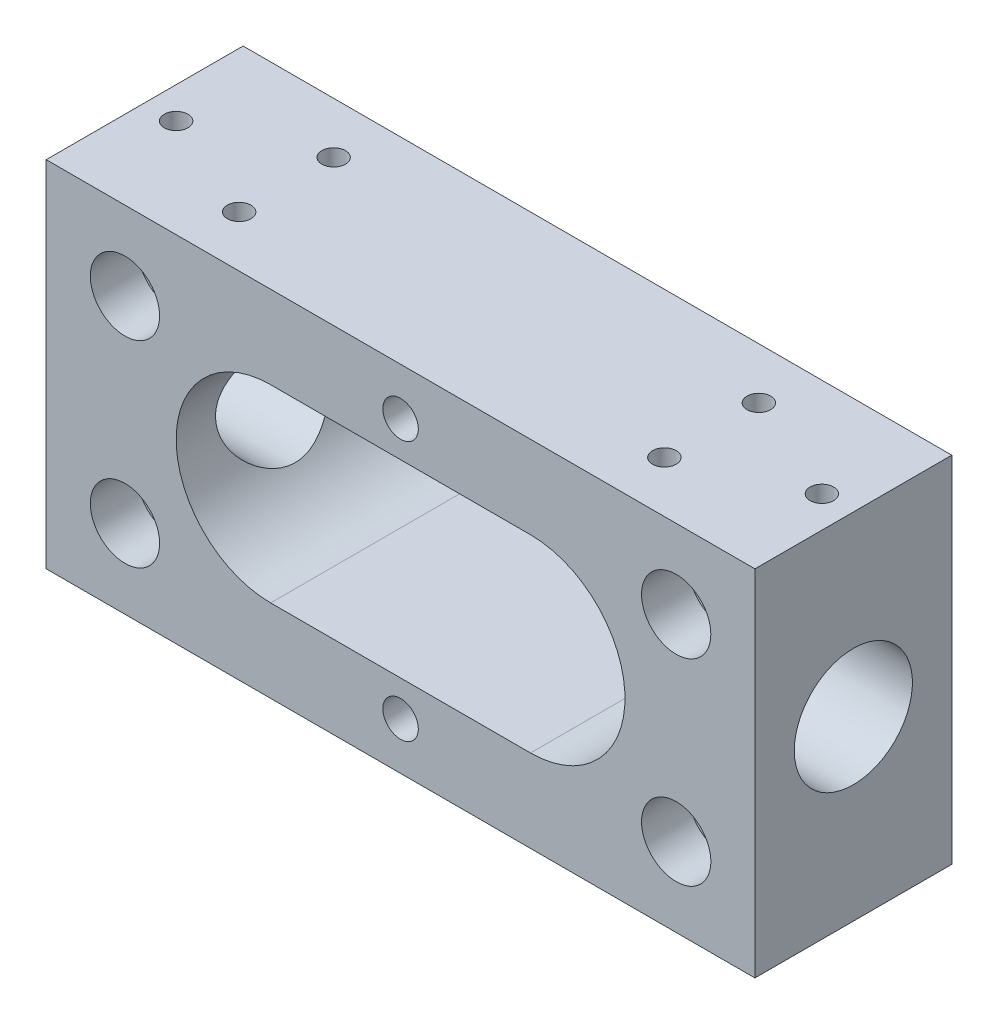
from build123d import *

# Parameters (mm, degrees)
SCHIZZO1_W                                           = 90
SCHIZZO1_H                                           = 45
ESTRUSIONE_ESTRUSIONE1_DEPTH                         = 25
SCHIZZO2_R                                           = 7.5
TAGLIO_ESTRUSIONE1_DEPTH                             = 104.682206767
FORO_LAMATO_PER_VITE_M4_A_TESTA_CILINDRI_D           = 4.5
FORO_LAMATO_PER_VITE_M4_A_TESTA_CILINDRI_CBORE_D     = 8
FORO_LAMATO_PER_VITE_M4_A_TESTA_CILINDRI_CBORE_DEPTH = 2.6
TAGLIO_ESTRUSIONE4_DEPTH                             = 104.682206767
SCHIZZO15_R                                          = 4.4
TAGLIO_ESTRUSIONE5_DEPTH                             = 6
SCHIZZO16_R                                          = 3
TAGLIO_ESTRUSIONE6_DEPTH                             = 103.401171975
SCHIZZO17_R                                          = 5
TAGLIO_ESTRUSIONE8_DEPTH                             = 10
FORO_3_0_3_1_D                                       = 3
FORO_3_0_3_1_DEPTH                                   = 12
FORO_3_0_3_1_TIP                                     = 0.901290929
FORO_3_0_3_2_D                                       = 3
FORO_3_0_3_2_DEPTH                                   = 12
FORO_3_0_3_2_TIP                                     = 0.901290929
FORO_3_0_3_3_D                                       = 3
FORO_3_0_3_3_DEPTH                                   = 12
FORO_3_0_3_3_TIP                                     = 0.901290929


with BuildPart() as part:
    # Schizzo1 → Estrusione-Estrusione1 (new body)
    with BuildSketch(Plane.XY):
        with Locations((45, 22.5)):
            Rectangle(SCHIZZO1_W, SCHIZZO1_H)
    extrude(amount=-ESTRUSIONE_ESTRUSIONE1_DEPTH)

    # Schizzo2 → Taglio-Estrusione1 (cut, through all)
    with BuildSketch(Plane.ZY):
        with Locations((-12.5, 22.5)):
            Circle(SCHIZZO2_R)
    extrude(amount=-TAGLIO_ESTRUSIONE1_DEPTH, mode=Mode.SUBTRACT)

    # Foro lamato per Vite M4 a testa cilindrica piana-1 (through all)
    with Locations(Plane(origin=(45, 39, -25), x_dir=(-1, 0, 0), z_dir=(0, 0, -1))):
        with Locations((0, 0), (0, -33)):
            CounterBoreHole(FORO_LAMATO_PER_VITE_M4_A_TESTA_CILINDRI_D / 2, FORO_LAMATO_PER_VITE_M4_A_TESTA_CILINDRI_CBORE_D / 2, FORO_LAMATO_PER_VITE_M4_A_TESTA_CILINDRI_CBORE_DEPTH)

    # Schizzo14 → Taglio-Estrusione4 (cut, through all)
    with BuildSketch(Plane.XY):
        with BuildLine():
            Line((61.5, 10.5), (28.5, 10.5))
            ThreePointArc((28.5, 10.5), (16.5, 22.5), (28.5, 34.5))
            Line((28.5, 34.5), (61.5, 34.5))
            ThreePointArc((61.5, 34.5), (73.5, 22.5), (61.5, 10.5))
        make_face()
    extrude(amount=-TAGLIO_ESTRUSIONE4_DEPTH, mode=Mode.SUBTRACT)

    # Schizzo15 → Taglio-Estrusione5 (cut)
    with BuildSketch(Plane.XY):
        with Locations((10, 10)):
            Circle(SCHIZZO15_R)
        with Locations((80, 10)):
            Circle(SCHIZZO15_R)
        with Locations((80, 35)):
            Circle(SCHIZZO15_R)
        with Locations((10, 35)):
            Circle(SCHIZZO15_R)
    extrude(amount=-TAGLIO_ESTRUSIONE5_DEPTH, mode=Mode.SUBTRACT)

    # Schizzo16 → Taglio-Estrusione6 (cut, through all)
    with BuildSketch(Plane.XY.offset(-6)):
        with Locations((10, 10)):
            Circle(SCHIZZO16_R)
        with Locations((80, 10)):
            Circle(SCHIZZO16_R)
        with Locations((80, 35)):
            Circle(SCHIZZO16_R)
        with Locations((10, 35)):
            Circle(SCHIZZO16_R)
    extrude(amount=-TAGLIO_ESTRUSIONE6_DEPTH, mode=Mode.SUBTRACT)

    # Schizzo17 → Taglio-Estrusione8 (cut)
    with BuildSketch(Plane(origin=(0, 0, -25), x_dir=(-1, 0, 0), z_dir=(0, 0, -1))):
        with Locations((-10, 10)):
            Circle(SCHIZZO17_R)
        with Locations((-80, 10)):
            Circle(SCHIZZO17_R)
        with Locations((-80, 35)):
            Circle(SCHIZZO17_R)
        with Locations((-10, 35)):
            Circle(SCHIZZO17_R)
    extrude(amount=-TAGLIO_ESTRUSIONE8_DEPTH, mode=Mode.SUBTRACT)

    # Foro Ø3.0 (3)-1
    with Locations(Plane(origin=(18, 45, -18.5), x_dir=(0, 0, 1), z_dir=(0, 1, 0))):
        with Locations((0, 0), (12, 0), (6, -14), (0, 54), (12, 54), (6, 68)):
            Hole(FORO_3_0_3_1_D / 2, depth=FORO_3_0_3_1_DEPTH)
            with Locations((0, 0, -(FORO_3_0_3_1_DEPTH + FORO_3_0_3_1_TIP / 2))):  # 118° drill point
                Cone(0, FORO_3_0_3_1_D / 2, FORO_3_0_3_1_TIP, mode=Mode.SUBTRACT)

    # Foro Ø3.0 (3)-2
    with Locations(Plane(origin=(18, 0, -6.5), x_dir=(0, 0, -1), z_dir=(0, -1, 0))):
        with Locations((0, 0), (6, -14), (12, 0), (0, 54), (12, 54), (6, 68)):
            Hole(FORO_3_0_3_2_D / 2, depth=FORO_3_0_3_2_DEPTH)
            with Locations((0, 0, -(FORO_3_0_3_2_DEPTH + FORO_3_0_3_2_TIP / 2))):  # 118° drill point
                Cone(0, FORO_3_0_3_2_D / 2, FORO_3_0_3_2_TIP, mode=Mode.SUBTRACT)

    # Foro Ø3.0 (3)-3
    with Locations(Plane(origin=(0, 41, -20), x_dir=(0, 0, -1), z_dir=(-1, 0, 0))):
        with Locations((0, 0), (0, 37)):
            Hole(FORO_3_0_3_3_D / 2, depth=FORO_3_0_3_3_DEPTH)
            with Locations((0, 0, -(FORO_3_0_3_3_DEPTH + FORO_3_0_3_3_TIP / 2))):  # 118° drill point
                Cone(0, FORO_3_0_3_3_D / 2, FORO_3_0_3_3_TIP, mode=Mode.SUBTRACT)


solid = part.part
